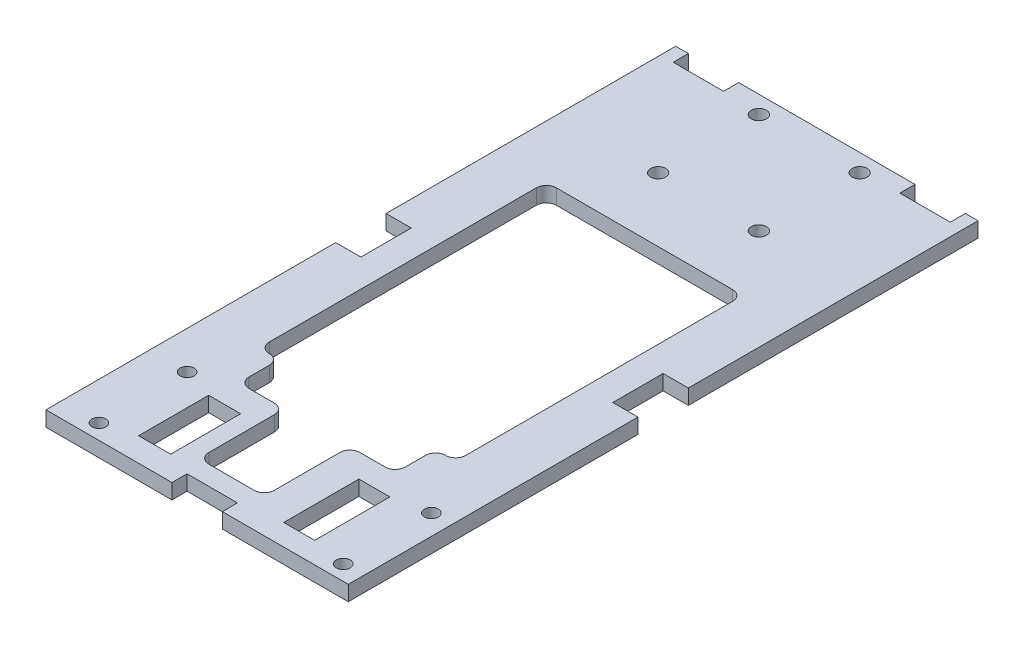
from build123d import *

# Parameters (mm, degrees)
CROQUIS1_R              = 1.5
CROQUIS1_R_2            = 1.375
CROQUIS1_W              = 6.357227068
CROQUIS1_H              = 13.910539406
CROQUIS1_W_2            = 6.149922685
CROQUIS1_H_2            = 14.93552652
SALIENTE_EXTRUIR1_DEPTH = 3


with BuildPart() as part:
    # Croquis1 → Saliente-Extruir1 (new body)
    with BuildSketch(Plane(origin=(0, 0, 0), x_dir=(1, 0, 0), z_dir=(0, 1, 0))):
        Polygon((0, 0), (25, 0), (25, 3), (35, 3), (35, 0), (60, 0), (60, 57.5), (55, 57.5), (55, 67.5), (60, 67.5), (60, 125), (57.5, 125), (57.5, 122), (47.5, 122), (47.5, 125), (12.5, 125), (12.5, 122), (2.5, 122), (2.5, 125), (0, 125), (0, 67.5), (5, 67.5), (5, 57.5), (0, 57.5), align=None)
        with Locations((20, 101.5)):
            Circle(CROQUIS1_R, mode=Mode.SUBTRACT)
        with Locations((20, 121.5)):
            Circle(CROQUIS1_R, mode=Mode.SUBTRACT)
        with Locations((40, 121.5)):
            Circle(CROQUIS1_R, mode=Mode.SUBTRACT)
        with Locations((40, 101.5)):
            Circle(CROQUIS1_R, mode=Mode.SUBTRACT)
        with Locations((7.5, 3)):
            Circle(CROQUIS1_R_2, mode=Mode.SUBTRACT)
        with Locations((7.5, 20.5)):
            Circle(CROQUIS1_R_2, mode=Mode.SUBTRACT)
        with Locations((56, 20.5)):
            Circle(CROQUIS1_R_2, mode=Mode.SUBTRACT)
        with Locations((56, 3)):
            Circle(CROQUIS1_R_2, mode=Mode.SUBTRACT)
        with Locations((16.821386466, 11.689804861)):
            Rectangle(CROQUIS1_W, CROQUIS1_H, mode=Mode.SUBTRACT)
        with Locations((46.033519219, 11.689804861)):
            Rectangle(CROQUIS1_W_2, CROQUIS1_H_2, mode=Mode.SUBTRACT)
        with BuildLine():
            Line((10.5, 33.818022813), (10.5, 86.818022813))
            ThreePointArc((10.5, 86.818022813), (11.085786438, 88.232236376), (12.5, 88.818022813))
            Line((12.5, 88.818022813), (47.5, 88.818022813))
            ThreePointArc((47.5, 88.818022813), (48.914213562, 88.232236376), (49.5, 86.818022813))
            Line((49.5, 86.818022813), (49.5, 33.818022813))
            ThreePointArc((49.5, 33.818022813), (48.914213562, 32.403809251), (47.5, 31.818022813))
            ThreePointArc((47.5, 31.818022813), (46.085786438, 31.232236376), (45.5, 29.818022813))
            Line((45.5, 29.818022813), (45.5, 25.818022813))
            ThreePointArc((45.5, 25.818022813), (44.914213562, 24.403809251), (43.5, 23.818022813))
            Line((43.5, 23.818022813), (38.5, 23.818022813))
            ThreePointArc((38.5, 23.818022813), (37.085786438, 23.232236376), (36.5, 21.818022813))
            Line((36.5, 21.818022813), (36.5, 8.818022813))
            ThreePointArc((36.5, 8.818022813), (35.914213562, 7.403809251), (34.5, 6.818022813))
            Line((34.5, 6.818022813), (25.5, 6.818022813))
            ThreePointArc((25.5, 6.818022813), (24.085786438, 7.403809251), (23.5, 8.818022813))
            Line((23.5, 8.818022813), (23.5, 21.818022813))
            ThreePointArc((23.5, 21.818022813), (22.914213562, 23.232236376), (21.5, 23.818022813))
            Line((21.5, 23.818022813), (16.5, 23.818022813))
            ThreePointArc((16.5, 23.818022813), (15.085786438, 24.403809251), (14.5, 25.818022813))
            Line((14.5, 25.818022813), (14.5, 29.818022813))
            ThreePointArc((14.5, 29.818022813), (13.914213562, 31.232236376), (12.5, 31.818022813))
            ThreePointArc((12.5, 31.818022813), (11.085786438, 32.403809251), (10.5, 33.818022813))
        make_face(mode=Mode.SUBTRACT)
    extrude(amount=SALIENTE_EXTRUIR1_DEPTH)


solid = part.part
